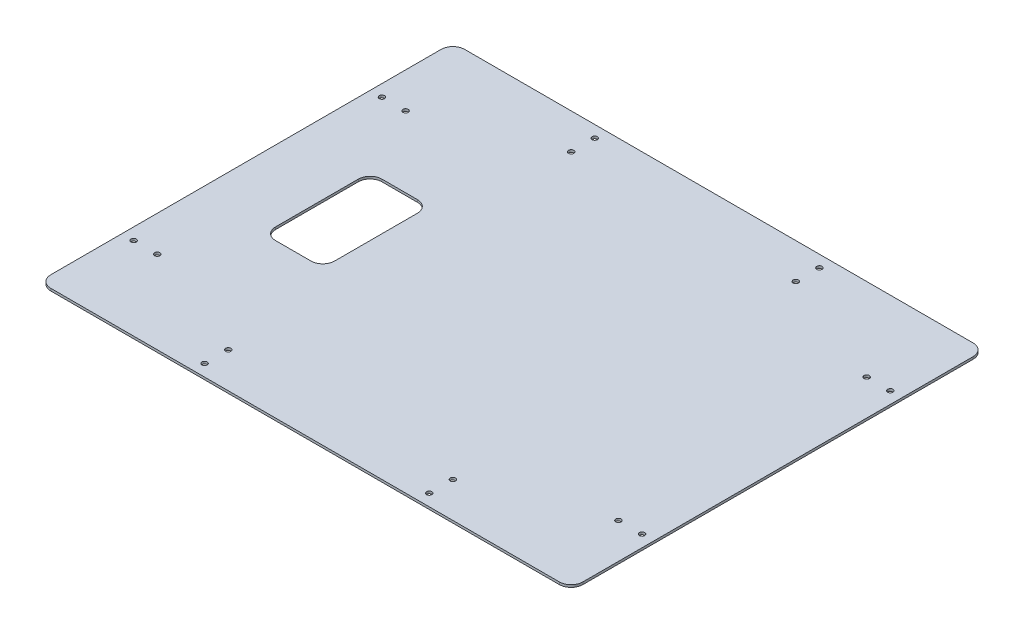
from build123d import *

# Parameters (mm, degrees)
SKETCH5_W            = 450
SKETCH5_H            = 350
BOSS_EXTRUDE1_DEPTH  = 2
FILLET1_R            = 10
CUT_EXTRUDE1_DEPTH   = 571.091220771
M4_CLEARANCE_HOLE1_D = 4.5


with BuildPart() as part:
    # Sketch5 → Boss-Extrude1 (new body)
    with BuildSketch(Plane(origin=(0, 0, 0), x_dir=(1, 0, 0), z_dir=(0, 1, 0))):
        with Locations((225, 175)):
            Rectangle(SKETCH5_W, SKETCH5_H)
    extrude(amount=BOSS_EXTRUDE1_DEPTH)

    # Fillet1
    fillet1_edges = [part.edges().sort_by_distance(p)[0] for p in [
        (0, 1, -350),
        (450, 1, -350),
        (450, 1, 0),
        (0, 1, 0),
    ]]
    fillet(fillet1_edges, radius=FILLET1_R)

    # Sketch6 → Cut-Extrude1 (cut, through all)
    with BuildSketch(Plane(origin=(0, 2, 0), x_dir=(1, 0, 0), z_dir=(0, 1, 0))):
        with BuildLine():
            Line((70, 220), (100, 220))
            ThreePointArc((100, 220), (107.071067812, 217.071067812), (110, 210))
            Line((110, 210), (110, 140))
            ThreePointArc((110, 140), (107.071067812, 132.928932188), (100, 130))
            Line((100, 130), (70, 130))
            ThreePointArc((70, 130), (62.928932188, 132.928932188), (60, 140))
            Line((60, 140), (60, 210))
            ThreePointArc((60, 210), (62.928932188, 217.071067812), (70, 220))
        make_face()
    extrude(amount=-CUT_EXTRUDE1_DEPTH, mode=Mode.SUBTRACT)

    # M4 Clearance Hole1 (through all)
    with Locations(Plane(origin=(0, 2, 0), x_dir=(1, 0, 0), z_dir=(0, 1, 0))):
        with Locations((130, 10), (130, 30), (10, 70), (30, 70), (320, 10), (320, 30), (420, 70), (440, 70), (440, 280), (420, 280), (320, 340), (320, 320), (130, 340), (130, 320), (30, 280), (10, 280)):
            Hole(M4_CLEARANCE_HOLE1_D / 2)


solid = part.part
